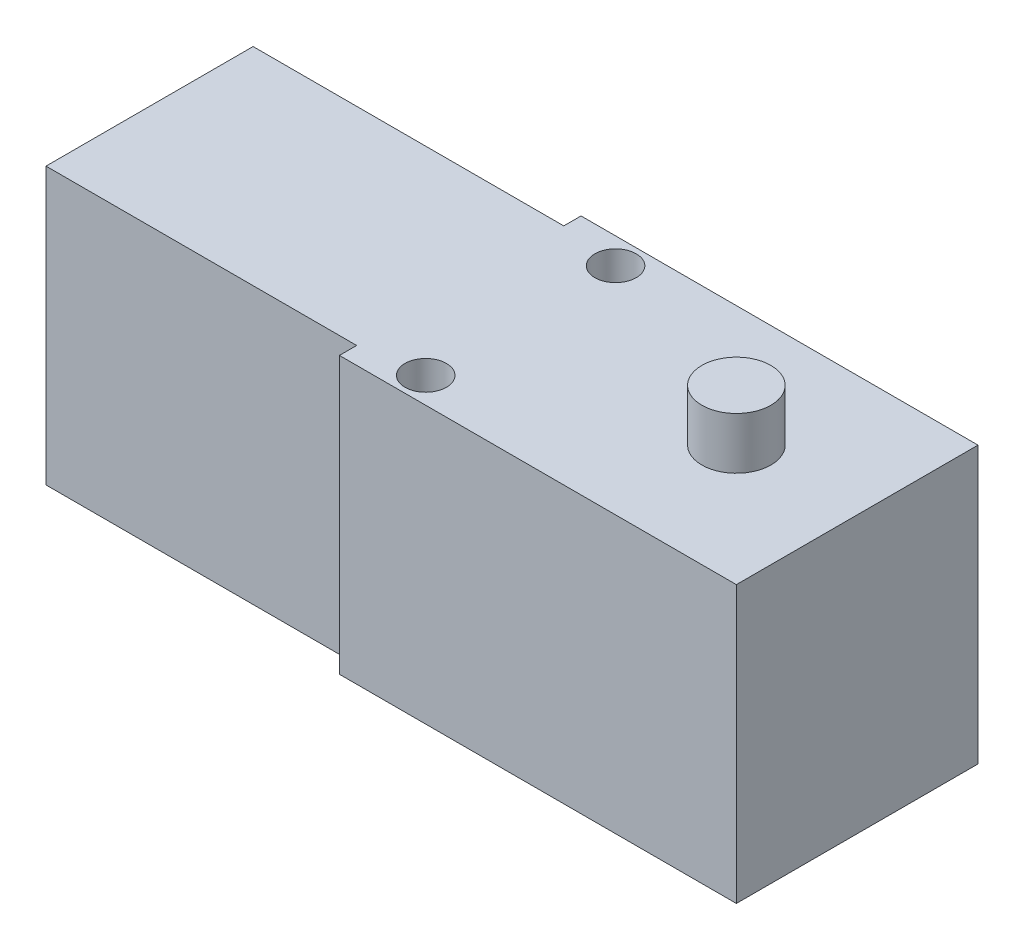
from build123d import *

# Parameters (mm, degrees)
BOSS_EXTRUDE1_DEPTH = 12.7
SKETCH2_R           = 3.175
BOSS_EXTRUDE2_DEPTH = 17.4625
SKETCH3_R           = 1.905
CUT_EXTRUDE1_DEPTH  = 49.645932191


with BuildPart() as part:
    # Sketch1 → Boss-Extrude1 (new, symmetric)
    with BuildSketch(Plane(origin=(0, 0, 0), x_dir=(1, 0, 0), z_dir=(0, 1, 0))):
        Polygon((-28.575, 9.525), (-28.575, -9.525), (0, -9.525), (0, -11.1125), (36.5125, -11.1125), (36.5125, 11.1125), (0, 11.1125), (0, 9.525), align=None)
    extrude(amount=BOSS_EXTRUDE1_DEPTH, both=True)

    # Sketch2 → Boss-Extrude2 (add, symmetric)
    with BuildSketch(Plane.XZ):
        with Locations((25.4, 0)):
            Circle(SKETCH2_R)
    extrude(amount=BOSS_EXTRUDE2_DEPTH, both=True)

    # Sketch3 → Cut-Extrude1 (cut, through all)
    with BuildSketch(Plane.XZ.offset(12.7)):
        with Locations((5.55625, 8.73125)):
            Circle(SKETCH3_R)
        with Locations((5.55625, -8.73125)):
            Circle(SKETCH3_R)
    extrude(amount=-CUT_EXTRUDE1_DEPTH, mode=Mode.SUBTRACT)


solid = part.part
